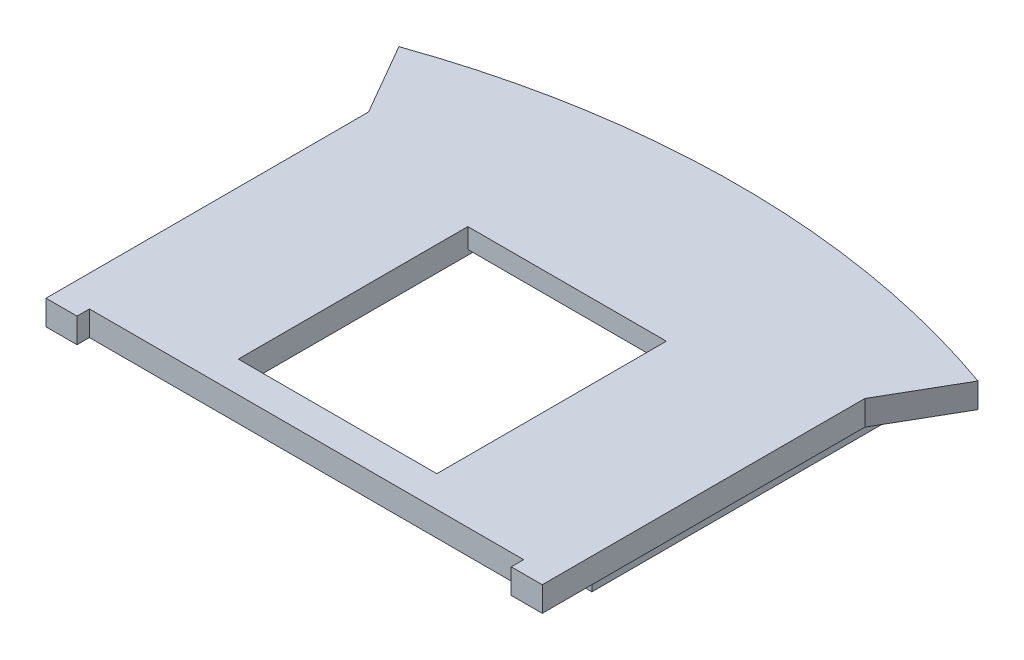
from build123d import *

# Parameters (mm, degrees)
BOSS_EXTRUDE1_DEPTH = 4
CUT_EXTRUDE1_REACH  = 149.251
SKETCH2_W           = 32
SKETCH2_H           = 37
SKETCH3_W           = 32
SKETCH3_H           = 44
CUT_EXTRUDE2_DEPTH  = 0.8
BOSS_EXTRUDE2_DEPTH = 3
CUT_EXTRUDE3_REACH  = 149.251
SKETCH5_W           = 70
SKETCH5_H           = 2


with BuildPart() as part:
    # Sketch1 → Boss-Extrude1 (new body)
    with BuildSketch(Plane(origin=(0, 0, 0), x_dir=(1, 0, 0), z_dir=(0, 1, 0))):
        with BuildLine():
            Line((-40, 68), (-40, 120))
            Line((-40, 120), (-46.677171015, 131.565199449))
            ThreePointArc((-46.677171015, 131.565199449), (0, 139.6), (46.677171015, 131.565199449))
            Line((46.677171015, 131.565199449), (40, 120))
            Line((40, 120), (40, 68))
            Line((40, 68), (-40, 68))
        make_face()
    extrude(amount=BOSS_EXTRUDE1_DEPTH)

    # Sketch2 → Cut-Extrude1 (cut, up to next)
    with BuildSketch(Plane(origin=(0, 4, 0), x_dir=(1, 0, 0), z_dir=(0, 1, 0)), mode=Mode.PRIVATE) as cut_extrude1_sk1:
        with Locations((0, 93.5)):
            Rectangle(SKETCH2_W, SKETCH2_H)
    cut_extrude1_tool1 = extrude(cut_extrude1_sk1.sketch, amount=-CUT_EXTRUDE1_REACH, mode=Mode.PRIVATE) & part.part
    add(cut_extrude1_tool1.solids().sort_by_distance((0, 4, -93.5))[0], mode=Mode.SUBTRACT)

    # Sketch3 → Cut-Extrude2 (cut)
    with BuildSketch(Plane.XZ):
        with Locations((0, -93.5)):
            Rectangle(SKETCH3_W, SKETCH3_H)
    extrude(amount=-CUT_EXTRUDE2_DEPTH, mode=Mode.SUBTRACT)

    # Sketch4 → Boss-Extrude2 (add)
    with BuildSketch(Plane.XZ):
        Polygon((-38, -78), (-38, -128), (38, -128), (38, -78), (35, -78), (35, -125), (-35, -125), (-35, -78), align=None)
    extrude(amount=BOSS_EXTRUDE2_DEPTH)

    # Sketch5 → Cut-Extrude3 (cut, up to next)
    with BuildSketch(Plane.XZ, mode=Mode.PRIVATE) as cut_extrude3_sk1:
        with Locations((0, -69)):
            Rectangle(SKETCH5_W, SKETCH5_H)
    cut_extrude3_tool1 = extrude(cut_extrude3_sk1.sketch, amount=-CUT_EXTRUDE3_REACH, mode=Mode.PRIVATE) & part.part
    add(cut_extrude3_tool1.solids().sort_by_distance((0, 0, -69))[0], mode=Mode.SUBTRACT)


solid = part.part
